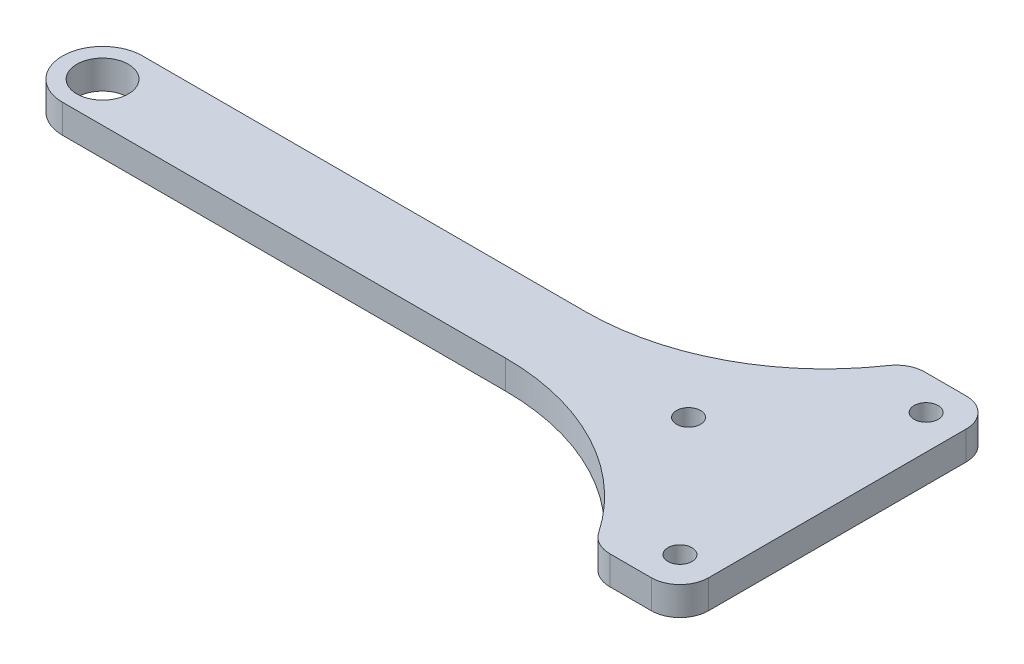
from build123d import *

# Parameters (mm, degrees)
SKETCH_1_R      = 4.5
EXTRUDE_1_DEPTH = 5
SKETCH_2_R      = 2.1
SKETCH_2_R_2    = 4.5
EXTRUDE_2_DEPTH = 5
FILLET_1_R      = 5


with BuildPart() as part:
    # 草图1 → 凸台-拉伸1 (new body)
    with BuildSketch(Plane(origin=(0, 0, 0), x_dir=(1, 0, 0), z_dir=(0, 1, 0))):
        with BuildLine():
            Line((-102.35, 7), (0, 7))
            ThreePointArc((0, 7), (7, 0), (0, -7))
            Line((0, -7), (-102.35, -7))
            ThreePointArc((-102.35, -7), (-109.35, 0), (-102.35, 7))
        make_face()
        with Locations((-102.35, 0)):
            Circle(SKETCH_1_R, mode=Mode.SUBTRACT)
        Circle(SKETCH_1_R, mode=Mode.SUBTRACT)
    extrude(amount=EXTRUDE_1_DEPTH)

    # 草图2 → 凸台-拉伸2 (add)
    # profile 1 of 2: a face of its own
    with BuildSketch(Plane.XZ):
        with BuildLine():
            Line((26, 27.5), (11, 27.5))
            ThreePointArc((11, 27.5), (-4.286176114, 12.484260492), (-25, 7))
            Line((-25, 7), (0, 7))
            ThreePointArc((0, 7), (7, 0), (0, -7))
            Line((0, -7), (-25, -7))
            ThreePointArc((-25, -7), (-4.286176114, -12.484260492), (11, -27.5))
            Line((11, -27.5), (26, -27.5))
            Line((26, -27.5), (26, 27.5))
        make_face()
        with Locations((20, -21.5)):
            Circle(SKETCH_2_R, mode=Mode.SUBTRACT)
        with Locations((20, 21.5)):
            Circle(SKETCH_2_R, mode=Mode.SUBTRACT)
    # profile 2 of 2: a face of its own
    with BuildSketch(Plane.XZ):
        Circle(SKETCH_2_R_2)
        Circle(SKETCH_2_R, mode=Mode.SUBTRACT)
    extrude(amount=-EXTRUDE_2_DEPTH)

    # 圆角1
    fillet_1_edges = [part.edges().sort_by_distance(p)[0] for p in [
        (11, 2.5, -27.5),
        (26, 2.5, 27.5),
        (11, 2.5, 27.5),
        (26, 2.5, -27.5),
    ]]
    fillet(fillet_1_edges, radius=FILLET_1_R)


solid = part.part
